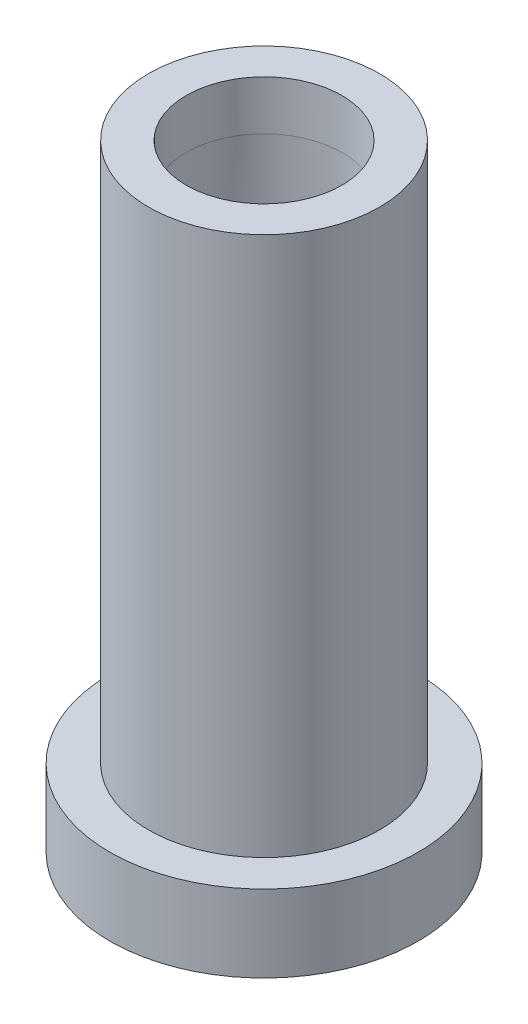
from build123d import *

# Parameters (mm, degrees)
CUT_EXTRUDE1_REACH = 44.426
SKETCH2_R          = 5.05


with BuildPart() as part:
    # Sketch1 → Revolve1 (revolve)
    with BuildSketch(Plane.XY):
        Polygon((0, 0), (10, 0), (10, 5), (7.5, 5), (7.5, 40), (0, 40), align=None)
    revolve(axis=Axis((0, 45, 0), (0, -1, 0)))

    # Sketch2 → Cut-Extrude1 (cut, up to next)
    with BuildSketch(Plane(origin=(0, 40, 0), x_dir=(1, 0, 0), z_dir=(0, 1, 0)), mode=Mode.PRIVATE) as cut_extrude1_sk1:
        Circle(SKETCH2_R)
    cut_extrude1_tool1 = extrude(cut_extrude1_sk1.sketch, amount=-CUT_EXTRUDE1_REACH, mode=Mode.PRIVATE) & part.part
    add(cut_extrude1_tool1.solids().sort_by_distance((0, 40, 0))[0], mode=Mode.SUBTRACT)

    # Cut-Sweep1: sweep along a curve in space
    with BuildLine() as cut_sweep1_path:
        ThreePointArc((0, 40, 5.05), (3.570889245, 40, 3.570889245), (5.05, 40, 0))
        ThreePointArc((5.05, 40, 0), (3.570889245, 40, -3.570889245), (0, 40, -5.05))
        ThreePointArc((0, 40, -5.05), (-3.570889245, 40, -3.570889245), (-5.05, 40, 0))
        ThreePointArc((-5.05, 40, 0), (-3.570889245, 40, 3.570889245), (0, 40, 5.05))
    # Sketch3 → Cut-Sweep1 (sweep, cut)
    with BuildSketch(Plane.XY):
        Polygon((5.05, 36.8), (6.013641914, 0), (5.05, 0), align=None)
    sweep(path=cut_sweep1_path.line, mode=Mode.SUBTRACT)


solid = part.part
